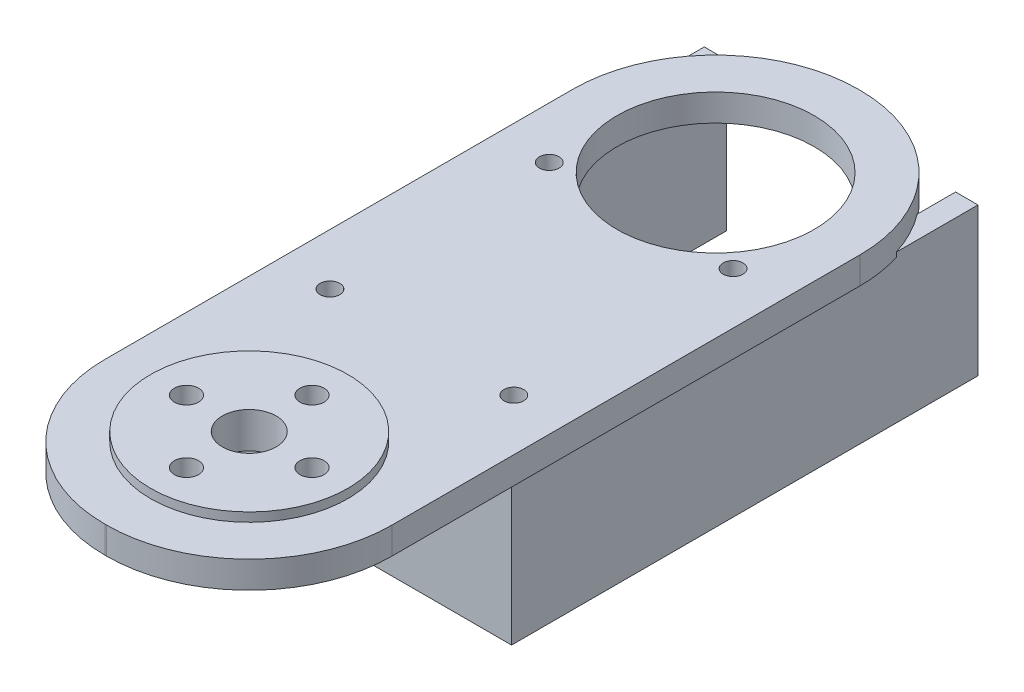
from build123d import *

# Parameters (mm, degrees)
S_CYL1_R      = 11
BOSS_1_DEPTH  = 1.1
BOSS_2_DEPTH  = 3
S_BOX3_W      = 2.5
S_BOX3_H      = 16.5
BOSS_3_DEPTH  = 52.01
S_BOX4_W      = 2.5
S_BOX4_H      = 16.5
BOSS_4_DEPTH  = 52.01
S_BOX5_W      = 30.52
S_BOX5_H      = 16.5
BOSS_5_DEPTH  = 2.5
S_HOLE6_R     = 3
HOLE_6_DEPTH  = 4.2
S_HOLE7_R     = 1.35
HOLE_7_DEPTH  = 4.2
S_HOLE8_R     = 1.35
HOLE_8_DEPTH  = 4.2
S_HOLE9_R     = 1.35
HOLE_9_DEPTH  = 4.2
S_HOLE10_R    = 1.35
HOLE_10_DEPTH = 4.2
S_HOLE11_R    = 11
HOLE_11_DEPTH = 3.2
S_HOLE12_R    = 1.1
HOLE_12_DEPTH = 3.2
S_HOLE13_R    = 1.1
HOLE_13_DEPTH = 3.2
S_HOLE14_R    = 1.1
HOLE_14_DEPTH = 3.2
S_HOLE15_R    = 1.1
HOLE_15_DEPTH = 3.2


with BuildPart() as part:
    # S_cyl1 → Boss_1 (new body)
    with BuildSketch(Plane(origin=(0, -1.1, 0), x_dir=(1, 0, 0), z_dir=(0, 1, 0))):
        Circle(S_CYL1_R)
    extrude(amount=BOSS_1_DEPTH)

    # S_prism2 → Boss_2 (add)
    with BuildSketch(Plane(origin=(0, -4, 0), x_dir=(1, 0, 0), z_dir=(0, 1, 0))):
        with BuildLine():
            Line((-0.1, -16), (0.1, -16))
            ThreePointArc((0.1, -16), (11.343, -11.343), (16, -0.1))
            Line((16, -0.1), (16, 52.1))
            ThreePointArc((16, 52.1), (11.343, 63.343), (0.1, 68))
            Line((0.1, 68), (-0.1, 68))
            ThreePointArc((-0.1, 68), (-11.343, 63.343), (-16, 52.1))
            Line((-16, 52.1), (-16, -0.1))
            ThreePointArc((-16, -0.1), (-11.343, -11.343), (-0.1, -16))
        make_face()
    extrude(amount=BOSS_2_DEPTH)

    # S_box3 → Boss_3 (add)
    with BuildSketch(Plane.XY.offset(-66)):
        with Locations((14.01, -11.75)):
            Rectangle(S_BOX3_W, S_BOX3_H)
    extrude(amount=BOSS_3_DEPTH)

    # S_box4 → Boss_4 (add)
    with BuildSketch(Plane.XY.offset(-66)):
        with Locations((-14.01, -11.75)):
            Rectangle(S_BOX4_W, S_BOX4_H)
    extrude(amount=BOSS_4_DEPTH)

    # S_box5 → Boss_5 (add)
    with BuildSketch(Plane.XY.offset(-16.49)):
        with Locations((0, -11.75)):
            Rectangle(S_BOX5_W, S_BOX5_H)
    extrude(amount=BOSS_5_DEPTH)

    # S_hole6 → Hole_6 (cut)
    with BuildSketch(Plane(origin=(0, -4.1, 0), x_dir=(1, 0, 0), z_dir=(0, 1, 0))):
        Circle(S_HOLE6_R)
    extrude(amount=HOLE_6_DEPTH, mode=Mode.SUBTRACT)

    # S_hole7 → Hole_7 (cut)
    with BuildSketch(Plane(origin=(0, -4.1, 0), x_dir=(1, 0, 0), z_dir=(0, 1, 0))):
        with Locations((7, 0)):
            Circle(S_HOLE7_R)
    extrude(amount=HOLE_7_DEPTH, mode=Mode.SUBTRACT)

    # S_hole8 → Hole_8 (cut)
    with BuildSketch(Plane(origin=(0, -4.1, 0), x_dir=(1, 0, 0), z_dir=(0, 1, 0))):
        with Locations((0, -7)):
            Circle(S_HOLE8_R)
    extrude(amount=HOLE_8_DEPTH, mode=Mode.SUBTRACT)

    # S_hole9 → Hole_9 (cut)
    with BuildSketch(Plane(origin=(0, -4.1, 0), x_dir=(1, 0, 0), z_dir=(0, 1, 0))):
        with Locations((-7, 0)):
            Circle(S_HOLE9_R)
    extrude(amount=HOLE_9_DEPTH, mode=Mode.SUBTRACT)

    # S_hole10 → Hole_10 (cut)
    with BuildSketch(Plane(origin=(0, -4.1, 0), x_dir=(1, 0, 0), z_dir=(0, 1, 0))):
        with Locations((0, 7)):
            Circle(S_HOLE10_R)
    extrude(amount=HOLE_10_DEPTH, mode=Mode.SUBTRACT)

    # S_hole11 → Hole_11 (cut)
    with BuildSketch(Plane(origin=(0, -4.1, 0), x_dir=(1, 0, 0), z_dir=(0, 1, 0))):
        with Locations((0, 52)):
            Circle(S_HOLE11_R)
    extrude(amount=HOLE_11_DEPTH, mode=Mode.SUBTRACT)

    # S_hole12 → Hole_12 (cut)
    with BuildSketch(Plane(origin=(0, -4.1, 0), x_dir=(1, 0, 0), z_dir=(0, 1, 0))):
        with Locations((-10.25, 43.7)):
            Circle(S_HOLE12_R)
    extrude(amount=HOLE_12_DEPTH, mode=Mode.SUBTRACT)

    # S_hole13 → Hole_13 (cut)
    with BuildSketch(Plane(origin=(0, -4.1, 0), x_dir=(1, 0, 0), z_dir=(0, 1, 0))):
        with Locations((10.25, 43.7)):
            Circle(S_HOLE13_R)
    extrude(amount=HOLE_13_DEPTH, mode=Mode.SUBTRACT)

    # S_hole14 → Hole_14 (cut)
    with BuildSketch(Plane(origin=(0, -4.1, 0), x_dir=(1, 0, 0), z_dir=(0, 1, 0))):
        with Locations((-10.25, 19.25)):
            Circle(S_HOLE14_R)
    extrude(amount=HOLE_14_DEPTH, mode=Mode.SUBTRACT)

    # S_hole15 → Hole_15 (cut)
    with BuildSketch(Plane(origin=(0, -4.1, 0), x_dir=(1, 0, 0), z_dir=(0, 1, 0))):
        with Locations((10.25, 19.25)):
            Circle(S_HOLE15_R)
    extrude(amount=HOLE_15_DEPTH, mode=Mode.SUBTRACT)


solid = part.part
